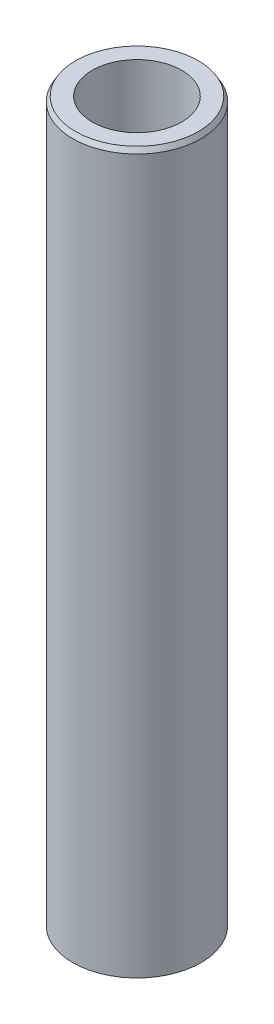
from build123d import *
from OCP.BRepFilletAPI import BRepFilletAPI_MakeChamfer

# Parameters (mm, degrees)
SKETCH1_R           = 47.5
BOSS_EXTRUDE1_DEPTH = 533.725468295
SKETCH2_R           = 33.157999429
CUT_EXTRUDE1_DEPTH  = 538.936218809
CHAMFER1_SIZE       = 3.551701032
CHAMFER1_SIZE2      = 2.050575547


with BuildPart() as part:
    # Sketch1 → Boss-Extrude1 (new body)
    with BuildSketch(Plane(origin=(0, 0, 0), x_dir=(1, 0, 0), z_dir=(0, 1, 0))):
        Circle(SKETCH1_R)
    extrude(amount=BOSS_EXTRUDE1_DEPTH)

    # Sketch2 → Cut-Extrude1 (cut, through all)
    with BuildSketch(Plane(origin=(0, 0, 0), x_dir=(1, 0, 0), z_dir=(0, 1, 0))):
        Circle(SKETCH2_R)
    extrude(amount=CUT_EXTRUDE1_DEPTH, mode=Mode.SUBTRACT)

    # Chamfer1: one chamfer whose edges measure the first distance from different faces: ONE call of the kernel's chamfer builder (chamfer() names one face for all edges)
    chamfer1_edges_1 = [part.edges().sort_by_distance(p)[0] for p in [
        (-47.5, 533.725468295, 0),
    ]]
    chamfer1_side_1 = [part.faces().sort_by_distance(p)[0] for p in [
        (-47.5, 266.862734147, 0),
    ]]
    chamfer1_edges_2 = [part.edges().sort_by_distance(p)[0] for p in [
        (-47.5, 0, 0),
    ]]
    chamfer1_side_2 = [part.faces().sort_by_distance(p)[0] for p in [
        (-46.156497116, 0, 0),
    ]]
    chamfer1 = BRepFilletAPI_MakeChamfer(part.part.solid().wrapped)
    for e in chamfer1_edges_1:
        chamfer1.Add(CHAMFER1_SIZE, CHAMFER1_SIZE2, e.wrapped, chamfer1_side_1[0].wrapped)  # the first distance lies on this face
    for e in chamfer1_edges_2:
        chamfer1.Add(CHAMFER1_SIZE, CHAMFER1_SIZE2, e.wrapped, chamfer1_side_2[0].wrapped)  # the first distance lies on this face
    add(Compound.cast(chamfer1.Shape()), mode=Mode.REPLACE)


solid = part.part
